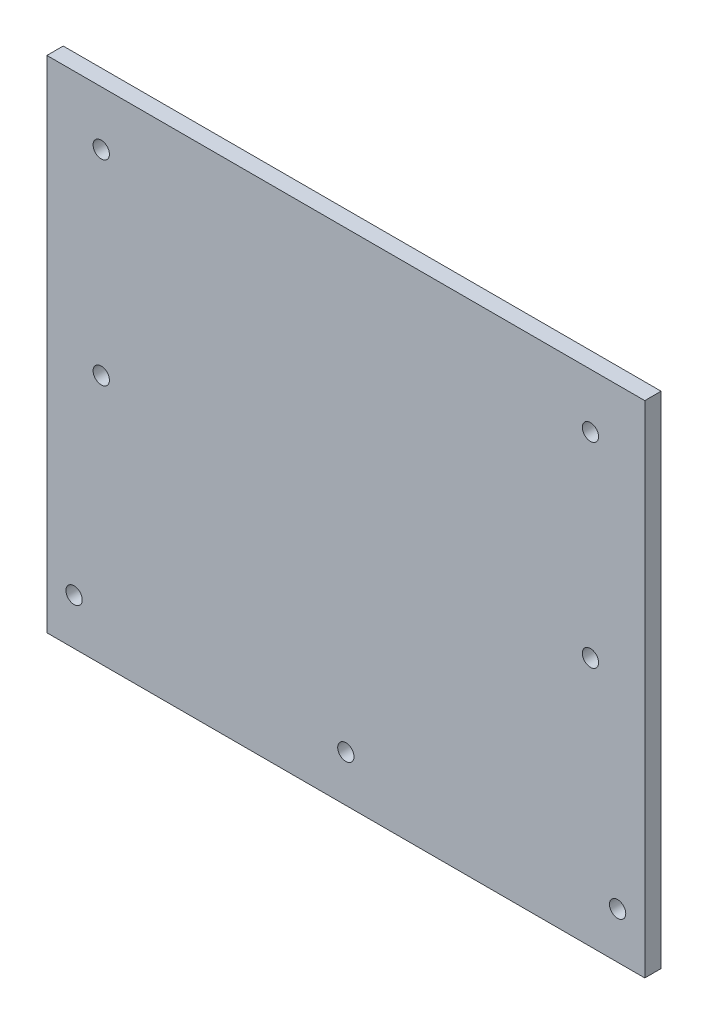
from build123d import *

# Parameters (mm, degrees)
SKETCH_1_W          = 110
SKETCH_1_H          = 92
EXTRUDE_1_DEPTH     = 3
SKETCH_2_R          = 1.5
CUT_EXTRUDE_1_DEPTH = 72.763500472
SKETCH_3_R          = 1.5
CUT_EXTRUDE_2_DEPTH = 72.763500472


with BuildPart() as part:
    # 草图1 → 凸台-拉伸1 (new body)
    with BuildSketch(Plane.XY):
        Rectangle(SKETCH_1_W, SKETCH_1_H)
    extrude(amount=EXTRUDE_1_DEPTH)

    # 草图2 → 切除-拉伸1 (cut, through all)
    with BuildSketch(Plane.XY.offset(3)):
        with Locations((0, -37.5)):
            Circle(SKETCH_2_R)
        with Locations((-50, -37.5)):
            Circle(SKETCH_2_R)
        with Locations((50, -37.5)):
            Circle(SKETCH_2_R)
    extrude(amount=-CUT_EXTRUDE_1_DEPTH, mode=Mode.SUBTRACT)

    # 草图3 → 切除-拉伸2 (cut, through all)
    with BuildSketch(Plane.XY.offset(3)):
        with Locations((-45, 36)):
            Circle(SKETCH_3_R)
        with Locations((45, 36)):
            Circle(SKETCH_3_R)
        with Locations((-45, 0)):
            Circle(SKETCH_3_R)
        with Locations((45, 0)):
            Circle(SKETCH_3_R)
    extrude(amount=-CUT_EXTRUDE_2_DEPTH, mode=Mode.SUBTRACT)


solid = part.part
